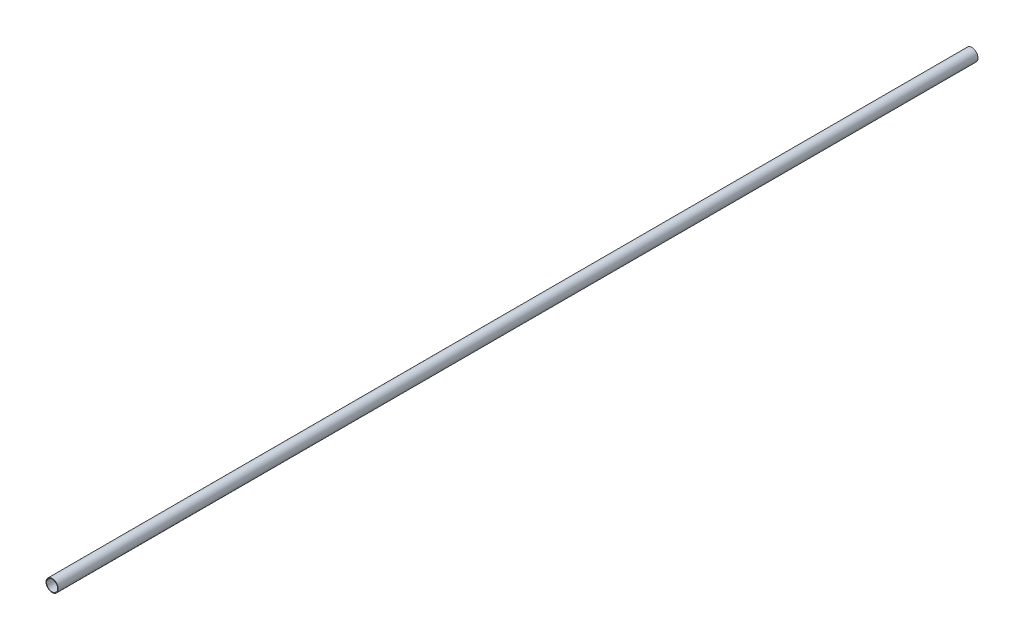
from build123d import *

# Parameters (mm, degrees)
SKETCH_1_R      = 10
SKETCH_1_R_2    = 9
EXTRUDE_1_DEPTH = 750


with BuildPart() as part:
    # Эскиз1 → Бобышка-Вытянуть1 (new, symmetric)
    with BuildSketch(Plane.XY):
        Circle(SKETCH_1_R)
        Circle(SKETCH_1_R_2, mode=Mode.SUBTRACT)
    extrude(amount=EXTRUDE_1_DEPTH, both=True)


solid = part.part
